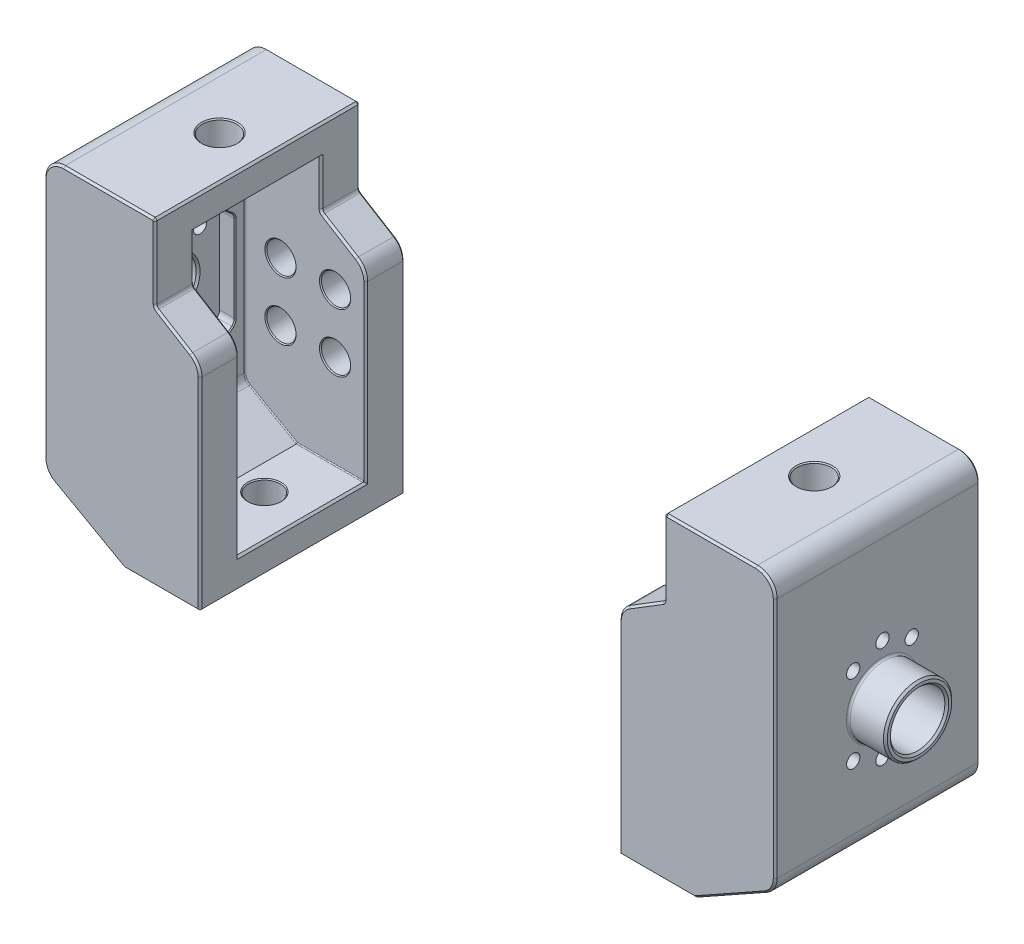
from build123d import *

# Parameters (mm, degrees)
DODANIE_WYCI_GNI_CIE1_DEPTH                         = 105
WYTNIJ_WYCI_GNI_CIE1_DEPTH                          = 65
SZKIC4_R                                            = 17.5
DODANIE_WYCI_GNI_CIE2_DEPTH                         = 19
WYTNIJ_WYCI_GNI_CIE2_REACH                          = 219.704
SZKIC5_R                                            = 14
POG_BIENIE_WALCOWE_POD_M8_WKR_T_Z_BEM_W_D           = 9
POG_BIENIE_WALCOWE_POD_M8_WKR_T_Z_BEM_W_DEPTH       = 47.5
POG_BIENIE_WALCOWE_POD_M8_WKR_T_Z_BEM_W_CBORE_D     = 15
POG_BIENIE_WALCOWE_POD_M8_WKR_T_Z_BEM_W_CBORE_DEPTH = 8.6
POG_BIENIE_WALCOWE_POD_M8_WKR_T_Z_BEM_W_TIP         = 2.703872786
ZAOKR_GLENIE3_R                                     = 10
SFAZOWANIE3_SIZE                                    = 1
SFAZOWANIE4_SIZE                                    = 1
SFAZOWANIE6_SIZE                                    = 1
ZAOKR_GLENIE4_R                                     = 3
SFAZOWANIE8_SIZE                                    = 1
ZAOKR_GLENIE5_R                                     = 0.5
SFAZOWANIE13_SIZE                                   = 0.5
SFAZOWANIE13_SIZE_2                                 = 0.477922207
SFAZOWANIE13_SIZE_3                                 = 0.525450382
SFAZOWANIE14_SIZE                                   = 0.5
SZKIC16_R                                           = 7.5
SZKIC16_R_2                                         = 4.5
WYTNIJ_WYCI_GNI_CIE8_DEPTH                          = 2.5
WYTNIJ_WYCI_GNI_CIE10_DEPTH                         = 8
ZAOKR_GLENIE8_R                                     = 4
OTW_R_GWINTOWANY_M81_D                              = 6.8
OTW_R_GWINTOWANY_M81_DEPTH                          = 22.25
OTW_R_GWINTOWANY_M81_TIP                            = 2.042926105
SFAZOWANIE15_SIZE                                   = 0.5
ZAOKR_GLENIE10_R                                    = 1
SFAZOWANIE16_SIZE                                   = 1


with BuildPart() as part:
    # Szkic2 → Dodanie-wyciągnięcie1 (new body)
    with BuildSketch(Plane.XY):
        with BuildLine():
            Line((-74.892509743, 20.134822539), (-39, 0))
            Line((-39, 0), (0, 0))
            Line((0, 0), (0, 104))
            ThreePointArc((0, 104), (-1.268353302, 108.874253372), (-4.751669188, 112.512051673))
            Line((-4.751669188, 112.512051673), (-22.049666162, 123.177589665))
            ThreePointArc((-22.049666162, 123.177589665), (-22.74632934, 123.905149326), (-23, 124.88))
            Line((-23, 124.88), (-23, 163))
            Line((-23, 163), (-80, 163))
            Line((-80, 163), (-80, 28.85625295))
            ThreePointArc((-80, 28.85625295), (-78.629168483, 23.802793611), (-74.892509743, 20.134822539))
        make_face()
    extrude(amount=DODANIE_WYCI_GNI_CIE1_DEPTH)

    # Szkic3 → Wytnij-wyciągnięcie1 (cut)
    with BuildSketch(Plane(origin=(0, 0, 20), x_dir=(-1, 0, 0), z_dir=(0, 0, -1))):
        with BuildLine():
            Line((62, 33.02957907), (62, 148))
            Line((62, 148), (23, 148))
            Line((23, 148), (23, 124.88))
            ThreePointArc((23, 124.88), (22.74632934, 123.905149326), (22.049666162, 123.177589665))
            Line((22.049666162, 123.177589665), (4.751669188, 112.512051673))
            ThreePointArc((4.751669188, 112.512051673), (1.268353302, 108.874253372), (0, 104))
            Line((0, 104), (0, 15))
            Line((0, 15), (35.080019286, 15))
            Line((35.080019286, 15), (59.446254871, 28.668863865))
            ThreePointArc((59.446254871, 28.668863865), (61.314584242, 30.502849401), (62, 33.02957907))
        make_face()
    extrude(amount=-WYTNIJ_WYCI_GNI_CIE1_DEPTH, mode=Mode.SUBTRACT)

    # Szkic4 → Dodanie-wyciągnięcie2 (add)
    with BuildSketch(Plane.ZY.offset(80)):
        with Locations(Location((50, 81.5, 0), (0, 0, 90))):
            Circle(SZKIC4_R)
    extrude(amount=DODANIE_WYCI_GNI_CIE2_DEPTH)

    # Szkic5 → Wytnij-wyciągnięcie2 (cut, up to next)
    with BuildSketch(Plane.ZY.offset(99), mode=Mode.PRIVATE) as wytnij_wyci_gni_cie2_sk1:
        with Locations(Location((50, 81.5, 0), (0, 0, 270))):
            Circle(SZKIC5_R)
    wytnij_wyci_gni_cie2_tool1 = extrude(wytnij_wyci_gni_cie2_sk1.sketch, amount=-WYTNIJ_WYCI_GNI_CIE2_REACH, mode=Mode.PRIVATE) & part.part
    add(wytnij_wyci_gni_cie2_tool1.solids().sort_by_distance((-99, 81.5, 50))[0], mode=Mode.SUBTRACT)

    # Pogłębienie walcowe pod M8 Wkręt z łbem walcowym z gniazdem sześciokątnym1
    with Locations(Plane.XY.offset(20)):
        with Locations((-43.741929592, 93), (-15.741929592, 93), (-43.741929592, 63), (-15.741929592, 63)):
            CounterBoreHole(POG_BIENIE_WALCOWE_POD_M8_WKR_T_Z_BEM_W_D / 2, POG_BIENIE_WALCOWE_POD_M8_WKR_T_Z_BEM_W_CBORE_D / 2, POG_BIENIE_WALCOWE_POD_M8_WKR_T_Z_BEM_W_CBORE_DEPTH, depth=POG_BIENIE_WALCOWE_POD_M8_WKR_T_Z_BEM_W_DEPTH)
            with Locations((0, 0, -(POG_BIENIE_WALCOWE_POD_M8_WKR_T_Z_BEM_W_DEPTH + POG_BIENIE_WALCOWE_POD_M8_WKR_T_Z_BEM_W_TIP / 2))):  # 118° drill point
                Cone(0, POG_BIENIE_WALCOWE_POD_M8_WKR_T_Z_BEM_W_D / 2, POG_BIENIE_WALCOWE_POD_M8_WKR_T_Z_BEM_W_TIP, mode=Mode.SUBTRACT)

    # Szkic13 → Wycięcie-obrót1 (revolve, cut)
    with BuildSketch(Plane(origin=(0, 0, 50), x_dir=(-1, 0, 0), z_dir=(0, 0, -1)), mode=Mode.PRIVATE) as wyci_cie_obr_t1_sk:
        Polygon((45, 167), (45, 148), (36.9, 148), (36, 167), align=None)
    revolve(wyci_cie_obr_t1_sk.sketch.rotate(Axis((-45, 167, 50), (0, -1, 0)), 90), axis=Axis((-45, 167, 50), (0, -1, 0)), mode=Mode.SUBTRACT)

    # Szkic14 → Wycięcie-obrót2 (revolve, cut)
    with BuildSketch(Plane(origin=(0, 0, 50), x_dir=(-1, 0, 0), z_dir=(0, 0, -1))):
        Polygon((22, -4), (22, 15), (13.9, 15), (13, -4), align=None)
    revolve(axis=Axis((-22, -4, 50), (0, 1, 0)), mode=Mode.SUBTRACT)

    # Zaokrąglenie3
    zaokr_glenie3_edges = [part.edges().sort_by_distance(p)[0] for p in [
        (-80, 163, 52.5),
    ]]
    fillet(zaokr_glenie3_edges, radius=ZAOKR_GLENIE3_R)

    # Sfazowanie3
    sfazowanie3_edges = [part.edges().sort_by_distance(p)[0] for p in [
        (-46.5, 163, 0),
        (-23, 143.94, 0),
        (-80, 90.928126475, 0),
        (-77.071067812, 160.071067812, 0),
        (-22.74632934, 123.905149326, 0),
        (-13.400667675, 117.844820669, 0),
        (-1.268353302, 108.874253372, 0),
        (0, 52, 0),
        (-19.5, 0, 0),
        (-56.946254871, 10.067411269, 0),
        (-78.629168483, 23.802793611, 0),
        (-23, 163, 52.5),
    ]]
    chamfer(sfazowanie3_edges, length=SFAZOWANIE3_SIZE)

    # Sfazowanie4
    sfazowanie4_edges = [part.edges().sort_by_distance(p)[0] for p in [
        (-80, 90.928126475, 105),
        (-77.071067812, 160.071067812, 105),
        (-19.5, 0, 105),
        (-47, 163, 105),
        (-23.5, 162.5, 105),
        (0, 52, 105),
        (-1.268353302, 108.874253372, 105),
        (-13.400667675, 117.844820669, 105),
        (-22.74632934, 123.905149326, 105),
        (-23, 143.44, 105),
        (-78.629168483, 23.802793611, 105),
        (-56.946254871, 10.067411269, 105),
    ]]
    chamfer(sfazowanie4_edges, length=SFAZOWANIE4_SIZE)

    # Sfazowanie6
    sfazowanie6_edges = [part.edges().sort_by_distance(p)[0] for p in [
        (0, 0, 52.5),
    ]]
    chamfer(sfazowanie6_edges, length=SFAZOWANIE6_SIZE)

    # Zaokrąglenie4
    zaokr_glenie4_edges = [part.edges().sort_by_distance(p)[0] for p in [
        (-39, 0, 52.5),
    ]]
    fillet(zaokr_glenie4_edges, radius=ZAOKR_GLENIE4_R)

    # Sfazowanie8
    sfazowanie8_edges = [part.edges().sort_by_distance(p)[0] for p in [
        (0, 59.5, 85),
        (0, 15, 52.5),
        (-1.268353302, 108.874253372, 85),
        (-13.400667675, 117.844820669, 85),
        (-22.74632934, 123.905149326, 85),
        (-23, 136.44, 85),
        (-23, 148, 52.5),
        (-23, 136.44, 20),
        (-22.74632934, 123.905149326, 20),
        (-13.400667675, 117.844820669, 20),
        (-1.268353302, 108.874253372, 20),
        (0, 59.5, 20),
    ]]
    chamfer(sfazowanie8_edges, length=SFAZOWANIE8_SIZE)

    # Zaokrąglenie5
    zaokr_glenie5_edges = [part.edges().sort_by_distance(p)[0] for p in [
        (-18.040009643, 15, 20),
        (-18.040009643, 15, 85),
        (-61.314584242, 30.502849401, 85),
        (-47.263137079, 21.834431932, 85),
        (-43, 148, 85),
        (-62, 90.514789535, 85),
        (-62, 148, 52.5),
        (-61.314584242, 30.502849401, 20),
        (-62, 90.514789535, 20),
        (-43, 148, 20),
        (-47.263137079, 21.834431932, 20),
    ]]
    fillet(zaokr_glenie5_edges, radius=ZAOKR_GLENIE5_R)

    # Sfazowanie13
    # the kernel refuses this chamfer: 0.525450382, 0.5, 0.477922207 mm, written as the material it takes off along each edge
    with BuildSketch(Plane(origin=(-45, 148, 50), x_dir=(0, 0, 1), z_dir=(1, 0, 0))) as sfazowanie13_piece_1:
        Polygon((8.1 + SFAZOWANIE13_SIZE, 0), (8.1 + SFAZOWANIE13_SIZE_2 * 0.0473153684751, -SFAZOWANIE13_SIZE_2 * 0.998880001141), (8.1, 0), align=None)
    revolve(axis=Axis((-45, 148, 50), (0, -1, 0)), mode=Mode.SUBTRACT)
    with BuildSketch(Plane(origin=(-45, 163, 50), x_dir=(0, 0, 1), z_dir=(-1, 0, 0))) as sfazowanie13_piece_2:
        Polygon((8.810526316 - SFAZOWANIE13_SIZE_3 * 0.0473153685005, -SFAZOWANIE13_SIZE_3 * 0.998880001676), (8.810526316 + SFAZOWANIE13_SIZE, 0), (8.810526316, 0), align=None)
    revolve(axis=Axis((-45, 163, 50), (0, 1, 0)), mode=Mode.SUBTRACT)
    with BuildSketch(Plane(origin=(-22, 15, 50), x_dir=(1, 0, 0), z_dir=(0, 0, 1))) as sfazowanie13_piece_3:
        Polygon((8.1 + SFAZOWANIE13_SIZE, 0), (8.1 + SFAZOWANIE13_SIZE_2 * 0.0473153684751, -SFAZOWANIE13_SIZE_2 * 0.998880001141), (8.1, 0), align=None)
    revolve(axis=Axis((-22, 15, 50), (0, 1, 0)), mode=Mode.SUBTRACT)
    with BuildSketch(Plane(origin=(-22, 0, 50), x_dir=(1, 0, 0), z_dir=(0, 0, -1))) as sfazowanie13_piece_4:
        Polygon((8.810526316 - SFAZOWANIE13_SIZE * 0.0473153684568, -SFAZOWANIE13_SIZE * 0.998880000755), (8.810526316 + SFAZOWANIE13_SIZE_3, 0), (8.810526316, 0), align=None)
    revolve(axis=Axis((-22, 0, 50), (0, -1, 0)), mode=Mode.SUBTRACT)

    # Sfazowanie14
    sfazowanie14_edges = [part.edges().sort_by_distance(p)[0] for p in [
        (-11.241929592, 63, 0),
        (-23.241929592, 63, 20),
        (-39.241929592, 63, 0),
        (-51.241929592, 63, 20),
        (-11.241929592, 93, 0),
        (-23.241929592, 93, 20),
        (-39.241929592, 93, 0),
        (-51.241929592, 93, 20),
    ]]
    chamfer(sfazowanie14_edges, length=SFAZOWANIE14_SIZE)

    # Szkic16 → Wytnij-wyciągnięcie8 (cut)
    # profile 1 of 4: a face of its own
    with BuildSketch(Plane.XY.offset(11.4)):
        with Locations((-43.741929592, 93)):
            Circle(SZKIC16_R)
        with Locations((-43.741929592, 93)):
            Circle(SZKIC16_R_2, mode=Mode.SUBTRACT)
    # profile 2 of 4: a face of its own
    with BuildSketch(Plane.XY.offset(11.4)):
        with Locations((-15.741929592, 63)):
            Circle(SZKIC16_R)
        with Locations((-15.741929592, 63)):
            Circle(SZKIC16_R_2, mode=Mode.SUBTRACT)
    # profile 3 of 4: a face of its own
    with BuildSketch(Plane.XY.offset(11.4)):
        with Locations((-15.741929592, 93)):
            Circle(SZKIC16_R)
        with Locations((-15.741929592, 93)):
            Circle(SZKIC16_R_2, mode=Mode.SUBTRACT)
    # profile 4 of 4: a face of its own
    with BuildSketch(Plane.XY.offset(11.4)):
        with Locations((-43.741929592, 63)):
            Circle(SZKIC16_R)
        with Locations((-43.741929592, 63)):
            Circle(SZKIC16_R_2, mode=Mode.SUBTRACT)
    extrude(amount=-WYTNIJ_WYCI_GNI_CIE8_DEPTH, mode=Mode.SUBTRACT)

    # Szkic17 → Wytnij-wyciągnięcie10 (cut)
    with BuildSketch(Plane(origin=(-62, 0, 0), x_dir=(0, 0, -1), z_dir=(1, 0, 0))):
        with BuildLine():
            Line((-75, 105.274986856), (-75, 57.725013144))
            ThreePointArc((-75, 57.725013144), (-50, 47), (-25, 57.725013144))
            Line((-25, 57.725013144), (-25, 105.274986856))
            ThreePointArc((-25, 105.274986856), (-50, 116), (-75, 105.274986856))
        make_face()
    extrude(amount=-WYTNIJ_WYCI_GNI_CIE10_DEPTH, mode=Mode.SUBTRACT)

    # Zaokrąglenie8
    zaokr_glenie8_edges = [part.edges().sort_by_distance(p)[0] for p in [
        (-66, 105.274986856, 75),
        (-66, 105.274986856, 25),
        (-66, 57.725013144, 25),
        (-66, 57.725013144, 75),
    ]]
    fillet(zaokr_glenie8_edges, radius=ZAOKR_GLENIE8_R)

    # Otwór gwintowany M81
    with Locations(Plane(origin=(-70, 0, 0), x_dir=(0, 0, -1), z_dir=(1, 0, 0))):
        with Locations((-65, 101.5), (-50, 107.5), (-35, 101.5), (-65, 61.5), (-50, 55.5), (-35, 61.5)):
            Hole(OTW_R_GWINTOWANY_M81_D / 2, depth=OTW_R_GWINTOWANY_M81_DEPTH)
            with Locations((0, 0, -(OTW_R_GWINTOWANY_M81_DEPTH + OTW_R_GWINTOWANY_M81_TIP / 2))):  # 118° drill point
                Cone(0, OTW_R_GWINTOWANY_M81_D / 2, OTW_R_GWINTOWANY_M81_TIP, mode=Mode.SUBTRACT)

    # Sfazowanie15
    sfazowanie15_edges = [part.edges().sort_by_distance(p)[0] for p in [
        (-62, 47, 50),
        (-62, 81.5, 75),
        (-62, 81.5, 25),
        (-62, 116, 50),
        (-62, 57.802458968, 74.675349877),
        (-62, 57.802458968, 25.324650123),
        (-62, 105.197541032, 25.324650123),
        (-62, 105.197541032, 74.675349877),
    ]]
    chamfer(sfazowanie15_edges, length=SFAZOWANIE15_SIZE)

    # Zaokrąglenie10
    zaokr_glenie10_edges = [part.edges().sort_by_distance(p)[0] for p in [
        (-80, 64, 50),
    ]]
    fillet(zaokr_glenie10_edges, radius=ZAOKR_GLENIE10_R)

    # Sfazowanie16
    sfazowanie16_edges = [part.edges().sort_by_distance(p)[0] for p in [
        (-70, 95.5, 50),
        (-99, 64, 50),
        (-99, 95.5, 50),
    ]]
    chamfer(sfazowanie16_edges, length=SFAZOWANIE16_SIZE)


with BuildPart() as body_2:
    # Lustro2: mirrored copy
    add(part.part.mirror(Plane(origin=(107.5, 0, 0), x_dir=(0, 0, 1), z_dir=(1, 0, 0))))


solid = Compound([part.part, body_2.part])
